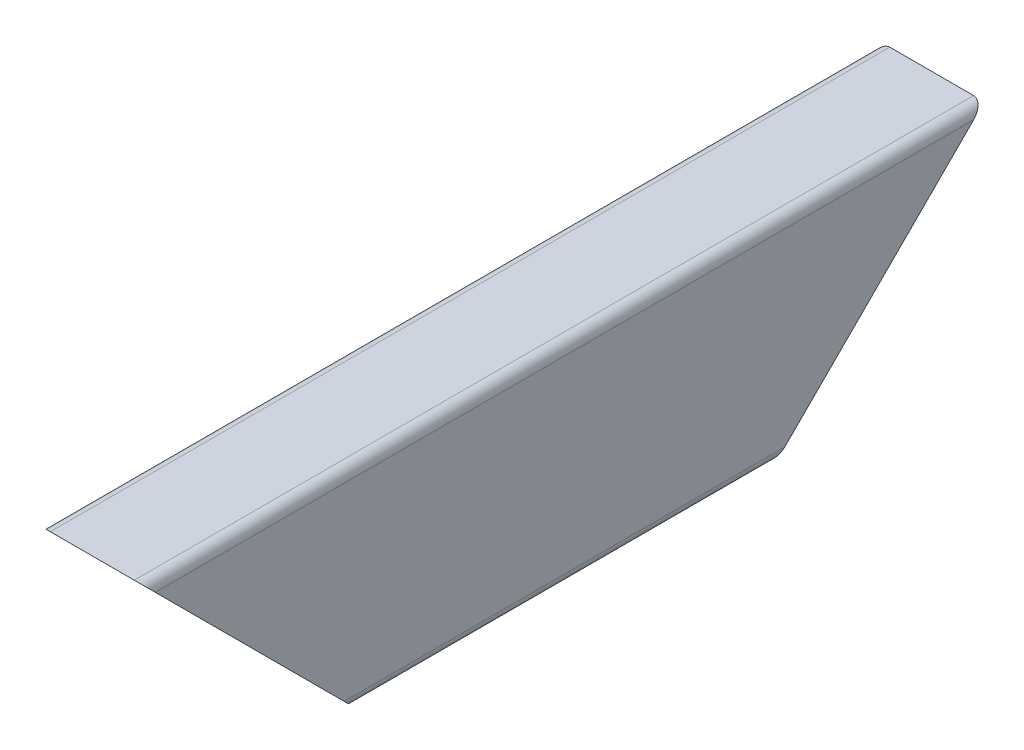
from build123d import *

# Parameters (mm, degrees)
EXTRUDE_THIN1_DEPTH = 203.2
CUT_EXTRUDE1_DEPTH  = 207.350575478


with BuildPart() as part:
    # Sketch1 → Extrude-Thin1 (new body)
    with BuildSketch(Plane.XY):
        with BuildLine():
            Line((-12.7, 22.86), (-12.7, -22.86))
            ThreePointArc((-12.7, -22.86), (-11.956051224, -24.656051224), (-10.16, -25.4))
            Line((-10.16, -25.4), (10.16, -25.4))
            ThreePointArc((10.16, -25.4), (11.956051224, -24.656051224), (12.7, -22.86))
            Line((12.7, -22.86), (12.7, 22.86))
            ThreePointArc((12.7, 22.86), (11.956051224, 24.656051224), (10.16, 25.4))
            Line((10.16, 25.4), (-10.16, 25.4))
            ThreePointArc((-10.16, 25.4), (-11.956051224, 24.656051224), (-12.7, 22.86))
        make_face()
        with BuildLine():
            Line((-11.1125, 22.86), (-11.1125, -22.86))
            ThreePointArc((-11.1125, -22.86), (-10.833519209, -23.533519209), (-10.16, -23.8125))
            Line((-10.16, -23.8125), (10.16, -23.8125))
            ThreePointArc((10.16, -23.8125), (10.833519209, -23.533519209), (11.1125, -22.86))
            Line((11.1125, -22.86), (11.1125, 22.86))
            ThreePointArc((11.1125, 22.86), (10.833519209, 23.533519209), (10.16, 23.8125))
            Line((10.16, 23.8125), (-10.16, 23.8125))
            ThreePointArc((-10.16, 23.8125), (-10.833519209, 23.533519209), (-11.1125, 22.86))
        make_face(mode=Mode.SUBTRACT)
    extrude(amount=EXTRUDE_THIN1_DEPTH)

    # Sketch2 → Cut-Extrude1 (cut, through all)
    with BuildSketch(Plane(origin=(12.7, 0, 0), x_dir=(0, 0, -1), z_dir=(1, 0, 0))):
        Polygon((-203.2, 25.4), (-152.4, -25.4), (-203.2, -25.4), align=None)
        Polygon((0, 25.4), (-50.8, -25.4), (0, -25.4), align=None)
    extrude(amount=-CUT_EXTRUDE1_DEPTH, mode=Mode.SUBTRACT)


solid = part.part
